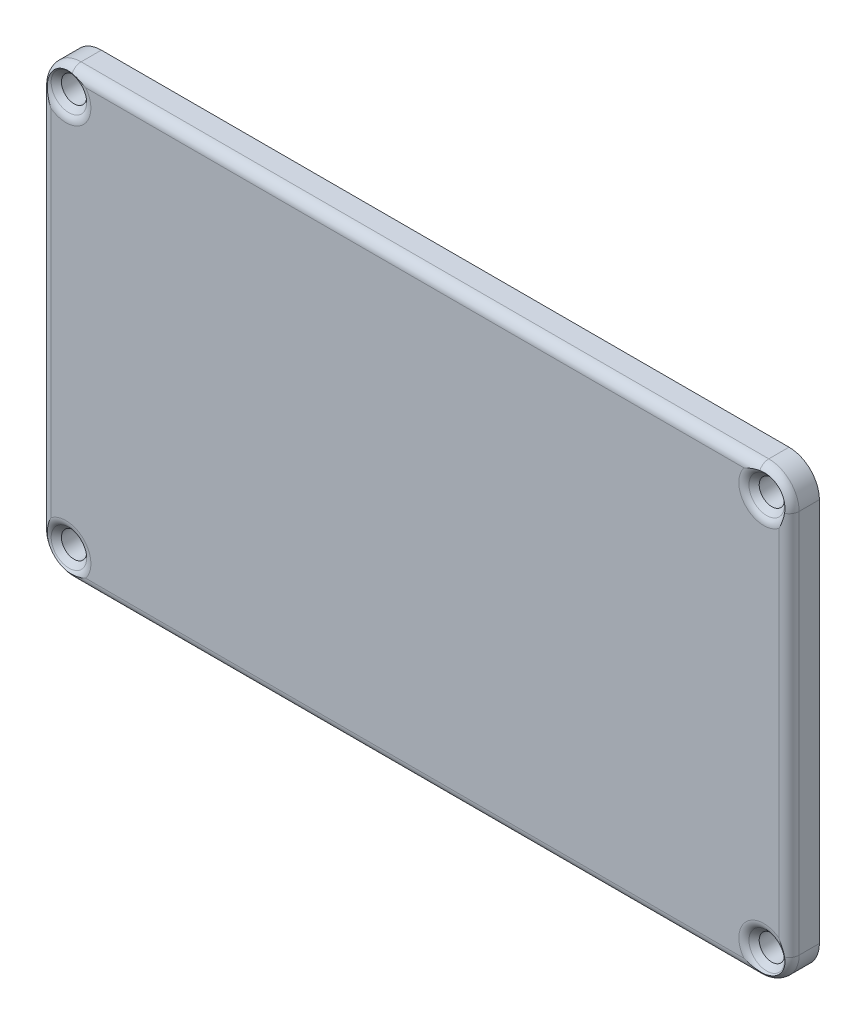
from build123d import *

# Parameters (mm, degrees)
IZIM1_W                     = 74
IZIM1_H                     = 44
Y_KSEKLIK_EKSTR_ZYON1_DEPTH = 3
IZIM2_R                     = 1.25
KES_EKSTR_ZYON1_DEPTH       = 44.150898021
RADYUS1_R                   = 3
PAH1_SIZE                   = 0.8
RADYUS2_R                   = 1


with BuildPart() as part:
    # Çizim1 → Yükseklik-Ekstrüzyon1 (new body)
    with BuildSketch(Plane.XY):
        Rectangle(IZIM1_W, IZIM1_H)
    extrude(amount=Y_KSEKLIK_EKSTR_ZYON1_DEPTH)

    # Çizim2 → Kes-Ekstrüzyon1 (cut, through all)
    with BuildSketch(Plane.XY.offset(3)):
        with Locations((-34.5, 19.5)):
            Circle(IZIM2_R)
        with Locations((-34.5, -19.5)):
            Circle(IZIM2_R)
        with Locations((34.5, 19.5)):
            Circle(IZIM2_R)
        with Locations((34.5, -19.5)):
            Circle(IZIM2_R)
    extrude(amount=-KES_EKSTR_ZYON1_DEPTH, mode=Mode.SUBTRACT)

    # Radyus1
    radyus1_edges = [part.edges().sort_by_distance(p)[0] for p in [
        (37, -22, 1.5),
        (-37, -22, 1.5),
        (-37, 22, 1.5),
        (37, 22, 1.5),
    ]]
    fillet(radyus1_edges, radius=RADYUS1_R)

    # Pah1
    pah1_edges = [part.edges().sort_by_distance(p)[0] for p in [
        (-35.75, -19.5, 3),
        (33.25, 19.5, 3),
        (33.25, -19.5, 3),
        (-35.75, 19.5, 3),
    ]]
    chamfer(pah1_edges, length=PAH1_SIZE)

    # Radyus2
    # the kernel refuses this fillet: 1 mm, written as the material it takes off along each edge
    with BuildSketch(Plane(origin=(34, -22, 3), x_dir=(0, 1, 0), z_dir=(-1, 0, 0)), Plane(origin=(-34, 22, 3), x_dir=(0, -1, 0), z_dir=(1, 0, 0))) as radyus2_piece_1:
        with BuildLine():
            CenterArc((RADYUS2_R, RADYUS2_R), RADYUS2_R, 180, 90)
            Line((0, RADYUS2_R), (0, 0))
            Line((0, 0), (RADYUS2_R, 0))
        make_face()
    extrude(amount=68, mode=Mode.SUBTRACT)
    with BuildSketch(Plane(origin=(-37, -19, 3), x_dir=(1, 0, 0), z_dir=(0, 1, 0)), Plane(origin=(37, 19, 3), x_dir=(-1, 0, 0), z_dir=(0, -1, 0))) as radyus2_piece_2:
        with BuildLine():
            CenterArc((RADYUS2_R, RADYUS2_R), RADYUS2_R, 180, 90)
            Line((0, RADYUS2_R), (0, 0))
            Line((0, 0), (RADYUS2_R, 0))
        make_face()
    extrude(amount=38, mode=Mode.SUBTRACT)
    with BuildSketch(Plane(origin=(-34, 19, 3), x_dir=(0, 1, 0), z_dir=(1, 0, 0))) as radyus2_piece_3:
        with BuildLine():
            CenterArc((3 - RADYUS2_R, -RADYUS2_R), RADYUS2_R, 0, 90)
            Line((3, -RADYUS2_R), (3, 0))
            Line((3, 0), (3 - RADYUS2_R, 0))
        make_face()
    revolve(axis=Axis((-34, 19, 3), (0, 0, 1)), revolution_arc=90, mode=Mode.SUBTRACT)
    with BuildSketch(Plane(origin=(34, 19, 3), x_dir=(0, 1, 0), z_dir=(-1, 0, 0))) as radyus2_piece_4:
        with BuildLine():
            CenterArc((3 - RADYUS2_R, RADYUS2_R), RADYUS2_R, 270, 90)
            Line((3, RADYUS2_R), (3, 0))
            Line((3, 0), (3 - RADYUS2_R, 0))
        make_face()
    revolve(axis=Axis((34, 19, 3), (0, 0, -1)), revolution_arc=90, mode=Mode.SUBTRACT)
    with BuildSketch(Plane(origin=(34, -19, 3), x_dir=(1, 0, 0), z_dir=(0, 1, 0))) as radyus2_piece_5:
        with BuildLine():
            CenterArc((3 - RADYUS2_R, RADYUS2_R), RADYUS2_R, 270, 90)
            Line((3, RADYUS2_R), (3, 0))
            Line((3, 0), (3 - RADYUS2_R, 0))
        make_face()
    revolve(axis=Axis((34, -19, 3), (0, 0, -1)), revolution_arc=90, mode=Mode.SUBTRACT)
    with BuildSketch(Plane(origin=(-34, -19, 3), x_dir=(-1, 0, 0), z_dir=(0, 1, 0))) as radyus2_piece_6:
        with BuildLine():
            CenterArc((3 - RADYUS2_R, -RADYUS2_R), RADYUS2_R, 0, 90)
            Line((3, -RADYUS2_R), (3, 0))
            Line((3, 0), (3 - RADYUS2_R, 0))
        make_face()
    revolve(axis=Axis((-34, -19, 3), (0, 0, 1)), revolution_arc=90, mode=Mode.SUBTRACT)
    with BuildSketch(Plane(origin=(-34.5, 19.5, 3), x_dir=(1, 0, 0), z_dir=(0, -1, 0))) as radyus2_piece_7:
        with BuildLine():
            CenterArc((2.05 + RADYUS2_R * 0.414213562373, -RADYUS2_R), RADYUS2_R, 90, 45)
            Line((2.05 - RADYUS2_R * 0.292893218813, -RADYUS2_R * 0.292893218813), (2.05, 0))
            Line((2.05, 0), (2.05 + RADYUS2_R * 0.414213562373, 0))
        make_face()
    revolve(axis=Axis((-34.5, 19.5, 3), (0, 0, 1)), mode=Mode.SUBTRACT)
    with BuildSketch(Plane(origin=(-34.5, -19.5, 3), x_dir=(1, 0, 0), z_dir=(0, -1, 0))) as radyus2_piece_8:
        with BuildLine():
            CenterArc((2.05 + RADYUS2_R * 0.414213562373, -RADYUS2_R), RADYUS2_R, 90, 45)
            Line((2.05 - RADYUS2_R * 0.292893218813, -RADYUS2_R * 0.292893218813), (2.05, 0))
            Line((2.05, 0), (2.05 + RADYUS2_R * 0.414213562373, 0))
        make_face()
    revolve(axis=Axis((-34.5, -19.5, 3), (0, 0, 1)), mode=Mode.SUBTRACT)
    with BuildSketch(Plane(origin=(34.5, -19.5, 3), x_dir=(1, 0, 0), z_dir=(0, -1, 0))) as radyus2_piece_9:
        with BuildLine():
            CenterArc((2.05 + RADYUS2_R * 0.414213562373, -RADYUS2_R), RADYUS2_R, 90, 45)
            Line((2.05 - RADYUS2_R * 0.292893218813, -RADYUS2_R * 0.292893218813), (2.05, 0))
            Line((2.05, 0), (2.05 + RADYUS2_R * 0.414213562373, 0))
        make_face()
    revolve(axis=Axis((34.5, -19.5, 3), (0, 0, 1)), mode=Mode.SUBTRACT)
    with BuildSketch(Plane(origin=(34.5, 19.5, 3), x_dir=(1, 0, 0), z_dir=(0, -1, 0))) as radyus2_piece_10:
        with BuildLine():
            CenterArc((2.05 + RADYUS2_R * 0.414213562373, -RADYUS2_R), RADYUS2_R, 90, 45)
            Line((2.05 - RADYUS2_R * 0.292893218813, -RADYUS2_R * 0.292893218813), (2.05, 0))
            Line((2.05, 0), (2.05 + RADYUS2_R * 0.414213562373, 0))
        make_face()
    revolve(axis=Axis((34.5, 19.5, 3), (0, 0, 1)), mode=Mode.SUBTRACT)


solid = part.part
